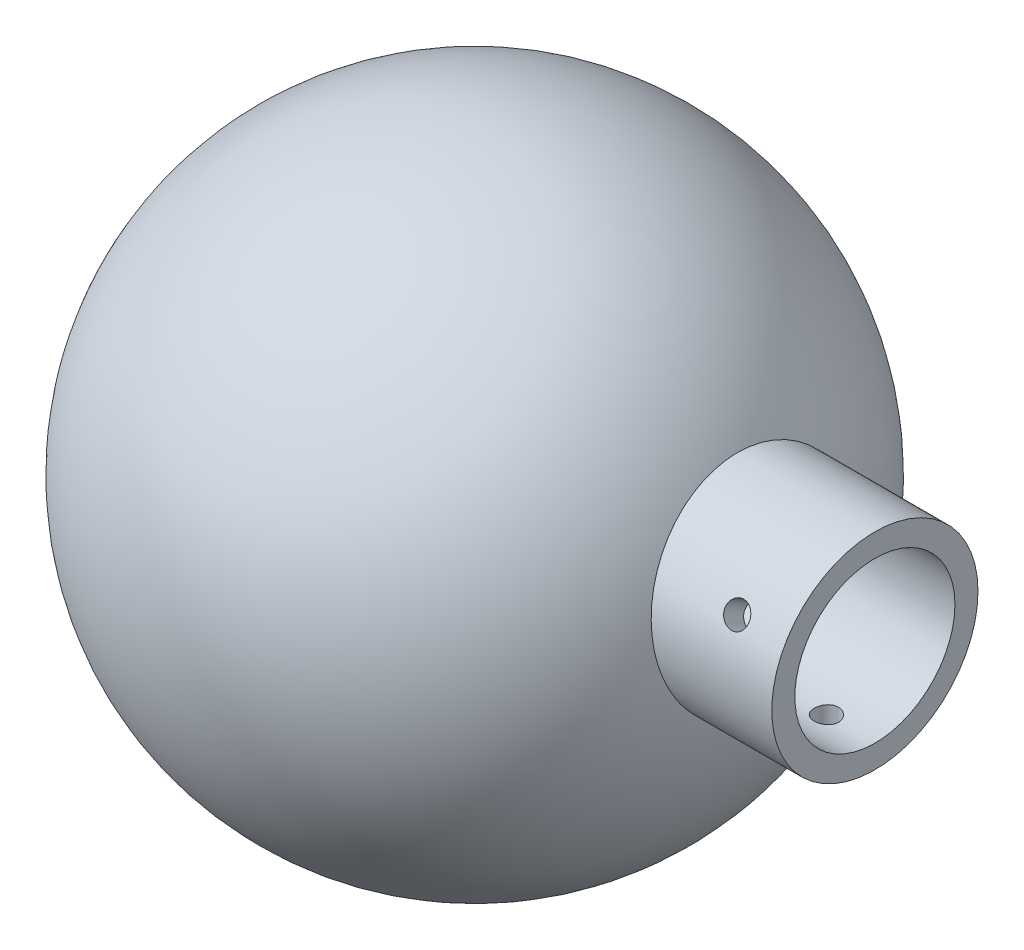
from build123d import *

# Parameters (mm, degrees)
SKETCH2_R                       = 21.59
SKETCH2_R_2                     = 16.764
BOSS_EXTRUDE1_DEPTH             = 83.82
BOSS_EXTRUDE1_DIRECTION_2_REACH = 111.985
SKETCH2_4_R                     = 16.764
CUT_EXTRUDE3_DEPTH              = 138.938
SKETCH4_R                       = 2.54
CUT_EXTRUDE4_DEPTH              = 138.938
CIRPATTERN1_COUNT               = 3


with BuildPart() as part:
    # Sketch1 → Revolve1 (revolve)
    with BuildSketch(Plane.XY):
        with BuildLine():
            Line((-63.5, 0), (-60.96, 0))
            ThreePointArc((-60.96, 0), (0, 60.96), (60.96, 0))
            Line((60.96, 0), (63.5, 0))
            ThreePointArc((63.5, 0), (0, 63.5), (-63.5, 0))
        make_face()
    revolve(axis=Axis((-63.5, 0, 0), (1, 0, 0)))

    # Sketch2 → Boss-Extrude1 (add)
    with BuildSketch(Plane(origin=(0, 0, 0), x_dir=(0, 0, -1), z_dir=(1, 0, 0))):
        with Locations((0, 10.0076)):
            Circle(SKETCH2_R)
        with Locations((0, 10.0076)):
            Circle(SKETCH2_R_2, mode=Mode.SUBTRACT)
    extrude(amount=BOSS_EXTRUDE1_DEPTH)

    # Sketch2 → Boss-Extrude1 direction 2 (add, up to next)
    with BuildSketch(Plane(origin=(0, 0, 0), x_dir=(0, 0, -1), z_dir=(1, 0, 0)), mode=Mode.PRIVATE) as boss_extrude1_direction_2_sk1:
        with Locations((0, 10.0076)):
            Circle(SKETCH2_R)
        with Locations((0, 10.0076)):
            Circle(SKETCH2_R_2, mode=Mode.SUBTRACT)
    boss_extrude1_direction_2_tool1 = extrude(boss_extrude1_direction_2_sk1.sketch, amount=-BOSS_EXTRUDE1_DIRECTION_2_REACH, mode=Mode.PRIVATE) - part.part
    add(boss_extrude1_direction_2_tool1.solids().sort_by_distance((0, 10.0076, 20.979343))[0])

    # Sketch2<4> → Cut-Extrude3 (cut)
    with BuildSketch(Plane(origin=(0, 0, 0), x_dir=(0, 0, -1), z_dir=(1, 0, 0))):
        with Locations((0, 10.0076)):
            Circle(SKETCH2_4_R)
    extrude(amount=CUT_EXTRUDE3_DEPTH, mode=Mode.SUBTRACT)

    # Sketch4 → Cut-Extrude4 (cut)
    with BuildSketch(Plane(origin=(0, 0, 0), x_dir=(1, 0, 0), z_dir=(0, 1, 0))):
        with Locations((73.66, 0)):
            Circle(SKETCH4_R)
    cut_extrude4 = extrude(amount=-CUT_EXTRUDE4_DEPTH, mode=Mode.SUBTRACT)

    # CirPattern1: Cut-Extrude4 ×3 about axis
    cirpattern1_axis = Axis((-63.502, 10.0076, 0), (1, 0, 0))
    for i in range(1, CIRPATTERN1_COUNT):
        add(cut_extrude4.rotate(cirpattern1_axis, i * 360 / CIRPATTERN1_COUNT), mode=Mode.SUBTRACT)


solid = part.part
